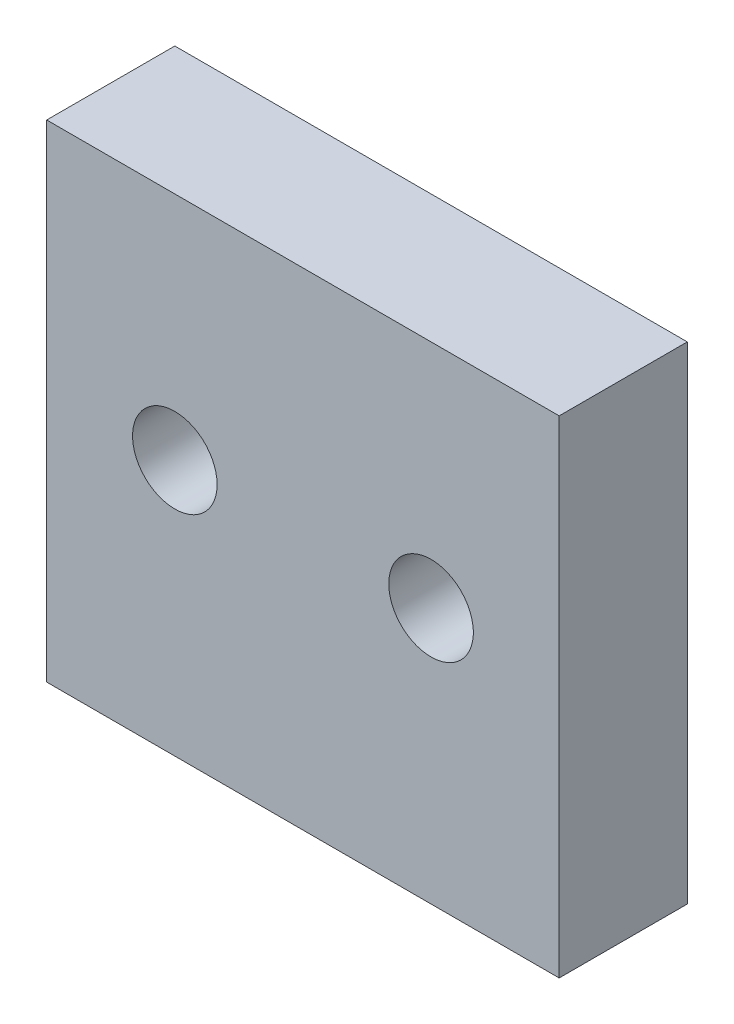
from build123d import *

# Parameters (mm, degrees)
SKETCH_1_W          = 20
SKETCH_1_H          = 20
SKETCH_1_R          = 1.65
EXTRUDE_1_DEPTH     = 5
SKETCH_2_W          = 20
SKETCH_2_H          = 1
CUT_EXTRUDE_1_DEPTH = 5


with BuildPart() as part:
    # 草图1 → 凸台-拉伸1 (new body)
    with BuildSketch(Plane.XY):
        Rectangle(SKETCH_1_W, SKETCH_1_H)
        with Locations((-5, 0)):
            Circle(SKETCH_1_R, mode=Mode.SUBTRACT)
        with Locations((5, 0)):
            Circle(SKETCH_1_R, mode=Mode.SUBTRACT)
    extrude(amount=EXTRUDE_1_DEPTH)

    # 草图2 → 切除-拉伸1 (cut)
    with BuildSketch(Plane.XY.offset(5)):
        with Locations((0, 9.5)):
            Rectangle(SKETCH_2_W, SKETCH_2_H)
    extrude(amount=-CUT_EXTRUDE_1_DEPTH, mode=Mode.SUBTRACT)


solid = part.part
